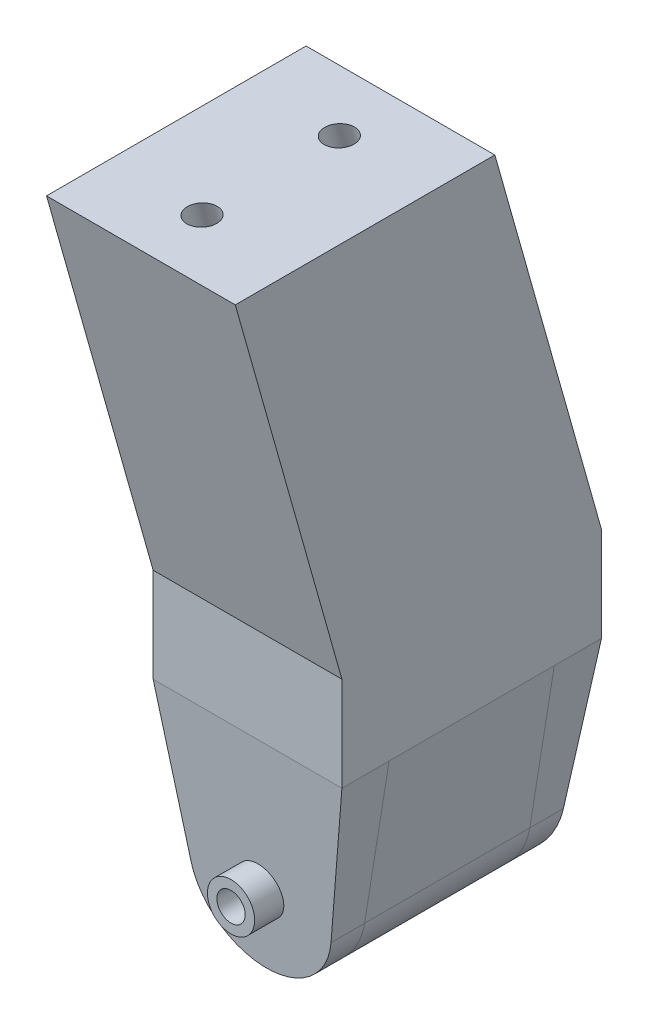
from build123d import *

# Parameters (mm, degrees)
CROQUIS1_W                          = 40
CROQUIS1_H                          = 55
SALIENTE_EXTRUIR1_DEPTH             = 20
SALIENTE_EXTRUIR2_REACH             = 41.449
SALIENTE_EXTRUIR2_DIRECTION_2_REACH = 41.449
CORTAR_EXTRUIR6_DEPTH               = 57.402570863
CORTAR_EXTRUIR6_DEPTH_BACK          = 57.402570863
CROQUIS6_R                          = 3
CORTAR_EXTRUIR10_DEPTH              = 10
CROQUIS11_R                         = 3
SALIENTE_EXTRUIR3_DEPTH             = 10
CORTAR_EXTRUIR11_DEPTH              = 57.402570863
CORTAR_EXTRUIR11_DEPTH_BACK         = 57.402570863
CORTAR_EXTRUIR15_START              = -10
CORTAR_EXTRUIR15_DEPTH              = 10
CROQUIS17_R                         = 3
SALIENTE_EXTRUIR4_DEPTH             = 10
CORTAR_EXTRUIR16_DEPTH              = 57.402570863
CORTAR_EXTRUIR16_DEPTH_BACK         = 57.402570863
CROQUIS21_R                         = 5
CROQUIS21_R_2                       = 3
SALIENTE_EXTRUIR5_DEPTH             = 3.5
SALIENTE_EXTRUIR5_DIRECTION_2_REACH = 75.824
CROQUIS22_R                         = 5
CROQUIS22_R_2                       = 3
SALIENTE_EXTRUIR6_DEPTH             = 3.5
SALIENTE_EXTRUIR6_DIRECTION_2_REACH = 78.467
BARRER1_START                       = -20
BARRER1_DEPTH                       = 40
CORTAR_EXTRUIR20_REACH              = 165.765
CROQUIS25_R                         = 3.1


# Read off the part's stored shape, not the designer's step: Barrer1
with BuildPart() as part:
    # Croquis1 → Saliente-Extruir1 (new body)
    with BuildSketch(Plane(origin=(0, 0, 0), x_dir=(1, 0, 0), z_dir=(0, 1, 0))):
        Rectangle(CROQUIS1_W, CROQUIS1_H)
    extrude(amount=SALIENTE_EXTRUIR1_DEPTH)

    # Saliente-Extruir2: up to this face of the body (flat: up to its plane)
    saliente_extruir2_end = Plane(part.part.faces().sort_by_distance((0, 10, 27.5))[0])
    # Croquis5 → Saliente-Extruir2 (add, up to the picked face)
    with BuildSketch(Plane.XY, mode=Mode.PRIVATE) as saliente_extruir2_sk1:
        with BuildLine():
            Line((-20, 0), (-14.810951292, -32.373967528))
            ThreePointArc((-14.810951292, -32.373967528), (0, -45), (14.810951292, -32.373967528))
            Line((14.810951292, -32.373967528), (20, 0))
            Line((20, 0), (-20, 0))
        make_face()
    saliente_extruir2_tool1 = split(extrude(saliente_extruir2_sk1.sketch, amount=SALIENTE_EXTRUIR2_REACH, mode=Mode.PRIVATE), bisect_by=saliente_extruir2_end, keep=Keep.BOTH, mode=Mode.PRIVATE)
    add(saliente_extruir2_tool1.solids().sort_by(Axis((0, -19.849245, 0), (0, 0, 1)))[0])

    # Saliente-Extruir2 direction 2: up to this face of the body (flat: up to its plane)
    saliente_extruir2_direction_2_end = Plane(part.part.faces().sort_by_distance((0, 10, -27.5))[0])
    # Croquis5 → Saliente-Extruir2 direction 2 (add, up to the picked face)
    with BuildSketch(Plane.XY, mode=Mode.PRIVATE) as saliente_extruir2_direction_2_sk1:
        with BuildLine():
            Line((-20, 0), (-14.810951292, -32.373967528))
            ThreePointArc((-14.810951292, -32.373967528), (0, -45), (14.810951292, -32.373967528))
            Line((14.810951292, -32.373967528), (20, 0))
            Line((20, 0), (-20, 0))
        make_face()
    saliente_extruir2_direction_2_tool1 = split(extrude(saliente_extruir2_direction_2_sk1.sketch, amount=-SALIENTE_EXTRUIR2_DIRECTION_2_REACH, mode=Mode.PRIVATE), bisect_by=saliente_extruir2_direction_2_end, keep=Keep.BOTH, mode=Mode.PRIVATE)
    add(saliente_extruir2_direction_2_tool1.solids().sort_by(Axis((0, -19.849245, 0), (0, 0, -1)))[0])

    # Croquis6 → Cortar-Extruir6 (cut, two sides: drawn at the far end of the back side and taken through both)
    with BuildSketch(Plane.XY.offset(-CORTAR_EXTRUIR6_DEPTH_BACK)):
        with Locations((0, -30)):
            Circle(CROQUIS6_R)
    extrude(amount=CORTAR_EXTRUIR6_DEPTH + CORTAR_EXTRUIR6_DEPTH_BACK, mode=Mode.SUBTRACT)

    # Croquis10 → Cortar-Extruir10 (cut)
    with BuildSketch(Plane(origin=(0, 0, -27.5), x_dir=(-1, 0, 0), z_dir=(0, 0, -1))):
        with BuildLine():
            Line((14.810951292, -32.373967528), (20, 0))
            Line((20, 0), (-20, 0))
            Line((-20, 0), (-14.810951292, -32.373967528))
            ThreePointArc((-14.810951292, -32.373967528), (0, -45), (14.810951292, -32.373967528))
        make_face()
    extrude(amount=-CORTAR_EXTRUIR10_DEPTH, mode=Mode.SUBTRACT)

    # Croquis16 → Cortar-Extruir15 (cut)
    with BuildSketch(Plane.XY.offset(27.5).offset(CORTAR_EXTRUIR15_START)):
        with BuildLine():
            Line((-20, 0), (20, 0))
            Line((20, 0), (14.810951292, -32.373967528))
            ThreePointArc((14.810951292, -32.373967528), (0, -45), (-14.810951292, -32.373967528))
            Line((-14.810951292, -32.373967528), (-20, 0))
        make_face()
    extrude(amount=CORTAR_EXTRUIR15_DEPTH, mode=Mode.SUBTRACT)

    # Barrer1 outline → Barrer1 (add)
    with BuildSketch(Plane.YZ.offset(BARRER1_START)):
        Polygon((20, -27.5), (100, -4.904361816), (100, 50.095638184), (20, 27.5), align=None)
    extrude(amount=BARRER1_DEPTH)

    # Cortar-Extruir20: up to this plane
    cortar_extruir20_end = Plane(origin=(0, 10, 0), z_dir=(0, 1, 0))
    # Croquis25 → Cortar-Extruir20 (cut, up to the surface)
    with BuildSketch(Plane(origin=(0, 105.715764038, 29.858939432), x_dir=(1, 0, 0), z_dir=(0, 0.9623504992532018, 0.27181154608867053)), mode=Mode.PRIVATE) as cortar_extruir20_sk1:
        with Locations(Location((0, 19.436230922, 0), (0, 0, 270))):
            Circle(CROQUIS25_R)
    cortar_extruir20_tool1 = split(extrude(cortar_extruir20_sk1.sketch, amount=-CORTAR_EXTRUIR20_REACH, mode=Mode.PRIVATE), bisect_by=cortar_extruir20_end, keep=Keep.BOTH, mode=Mode.PRIVATE)
    add(cortar_extruir20_tool1.solids().sort_by_distance((0, 110.998756, 11.154473))[0], mode=Mode.SUBTRACT)
    # Croquis25 → Cortar-Extruir20 (cut, up to the surface)
    with BuildSketch(Plane(origin=(0, 105.715764038, 29.858939432), x_dir=(1, 0, 0), z_dir=(0, 0.9623504992532018, 0.27181154608867053)), mode=Mode.PRIVATE) as cortar_extruir20_sk2:
        with Locations(Location((0, -8.563769078, 0), (0, 0, 270))):
            Circle(CROQUIS25_R)
    cortar_extruir20_tool2 = split(extrude(cortar_extruir20_sk2.sketch, amount=-CORTAR_EXTRUIR20_REACH, mode=Mode.PRIVATE), bisect_by=cortar_extruir20_end, keep=Keep.BOTH, mode=Mode.PRIVATE)
    add(cortar_extruir20_tool2.solids().sort_by_distance((0, 103.388033, 38.100287))[0], mode=Mode.SUBTRACT)


with BuildPart() as body_2:
    # Croquis11 → Saliente-Extruir3 (new body)
    with BuildSketch(Plane(origin=(0, 0, -17.5), x_dir=(-1, 0, 0), z_dir=(0, 0, -1))):
        with BuildLine():
            Line((20, 0), (-20, 0))
            Line((-20, 0), (-14.810951292, -32.373967528))
            ThreePointArc((-14.810951292, -32.373967528), (0, -45), (14.810951292, -32.373967528))
            Line((14.810951292, -32.373967528), (20, 0))
        make_face()
        with Locations((0, -30)):
            Circle(CROQUIS11_R, mode=Mode.SUBTRACT)
    extrude(amount=SALIENTE_EXTRUIR3_DEPTH)

    # Croquis12 → Cortar-Extruir11 (cut, two sides: drawn at the far end of the back side and taken through both)
    with BuildSketch(Plane(origin=(0, 0, 0), x_dir=(0, 0, -1), z_dir=(1, 0, 0)).offset(-CORTAR_EXTRUIR11_DEPTH_BACK)):
        with BuildLine():
            Line((27.5, 0), (23.5, -45))
            add(Edge.make_bspline(
                [(23.5, -45), (53.895048744, -65.691423054), (27.5, 0)],
                knots=[0, 0, 0, 1, 1, 1], degree=2))
        make_face()
    extrude(amount=CORTAR_EXTRUIR11_DEPTH + CORTAR_EXTRUIR11_DEPTH_BACK, mode=Mode.SUBTRACT)

    # Croquis22 → Saliente-Extruir6 (add)
    with BuildSketch(Plane(origin=(0, 0, -27.5), x_dir=(-1, 0, 0), z_dir=(0, 0, -1))):
        with Locations(Location((0, -30, 0), (0, 0, 180))):
            Circle(CROQUIS22_R)
        with Locations(Location((0, -30, 0), (0, 0, 180))):
            Circle(CROQUIS22_R_2, mode=Mode.SUBTRACT)
    extrude(amount=SALIENTE_EXTRUIR6_DEPTH)

    # Saliente-Extruir6 direction 2: up to this face of the body (flat: up to its plane)
    saliente_extruir6_direction_2_end = Plane(body_2.part.faces().sort_by_distance((0, -19.641450964, -25.754093248))[0])
    # Croquis22 → Saliente-Extruir6 direction 2 (add, up to the picked face)
    with BuildSketch(Plane(origin=(0, 0, -27.5), x_dir=(-1, 0, 0), z_dir=(0, 0, -1)), mode=Mode.PRIVATE) as saliente_extruir6_direction_2_sk1:
        with Locations(Location((0, -30, 0), (0, 0, 180))):
            Circle(CROQUIS22_R)
        with Locations(Location((0, -30, 0), (0, 0, 180))):
            Circle(CROQUIS22_R_2, mode=Mode.SUBTRACT)
    saliente_extruir6_direction_2_tool1 = split(extrude(saliente_extruir6_direction_2_sk1.sketch, amount=-SALIENTE_EXTRUIR6_DIRECTION_2_REACH, mode=Mode.PRIVATE), bisect_by=saliente_extruir6_direction_2_end, keep=Keep.BOTH, mode=Mode.PRIVATE)
    add(saliente_extruir6_direction_2_tool1.solids().sort_by(Axis((-4.858579, -30, -27.5), (0, 0, 1)))[0])


with BuildPart() as body_3:
    # Croquis17 → Saliente-Extruir4 (new body)
    with BuildSketch(Plane.XY.offset(17.5)):
        with BuildLine():
            Line((14.810951292, -32.373967528), (20, 0))
            Line((20, 0), (-20, 0))
            Line((-20, 0), (-14.810951292, -32.373967528))
            ThreePointArc((-14.810951292, -32.373967528), (0, -45), (14.810951292, -32.373967528))
        make_face()
        with Locations(Location((0, -30, 0), (0, 0, 180))):
            Circle(CROQUIS17_R, mode=Mode.SUBTRACT)
    extrude(amount=SALIENTE_EXTRUIR4_DEPTH)

    # Croquis18 → Cortar-Extruir16 (cut, two sides: drawn at the far end of the back side and taken through both)
    with BuildSketch(Plane(origin=(0, 0, 0), x_dir=(0, 0, -1), z_dir=(1, 0, 0)).offset(-CORTAR_EXTRUIR16_DEPTH_BACK)):
        with BuildLine():
            Line((-27.5, 0), (-23.5, -45))
            add(Edge.make_bspline(
                [(-23.5, -45), (-50.99373039, -70.964066745), (-27.5, 0)],
                knots=[0, 0, 0, 1, 1, 1], degree=2))
        make_face()
    extrude(amount=CORTAR_EXTRUIR16_DEPTH + CORTAR_EXTRUIR16_DEPTH_BACK, mode=Mode.SUBTRACT)

    # Croquis21 → Saliente-Extruir5 (add)
    with BuildSketch(Plane.XY.offset(27.5)):
        with Locations((0, -30)):
            Circle(CROQUIS21_R)
        with Locations((0, -30)):
            Circle(CROQUIS21_R_2, mode=Mode.SUBTRACT)
    extrude(amount=SALIENTE_EXTRUIR5_DEPTH)

    # Saliente-Extruir5 direction 2: up to this face of the body (flat: up to its plane)
    saliente_extruir5_direction_2_end = Plane(body_3.part.faces().sort_by_distance((0, -19.641450964, 25.754093248))[0])
    # Croquis21 → Saliente-Extruir5 direction 2 (add, up to the picked face)
    with BuildSketch(Plane.XY.offset(27.5), mode=Mode.PRIVATE) as saliente_extruir5_direction_2_sk1:
        with Locations((0, -30)):
            Circle(CROQUIS21_R)
        with Locations((0, -30)):
            Circle(CROQUIS21_R_2, mode=Mode.SUBTRACT)
    saliente_extruir5_direction_2_tool1 = split(extrude(saliente_extruir5_direction_2_sk1.sketch, amount=-SALIENTE_EXTRUIR5_DIRECTION_2_REACH, mode=Mode.PRIVATE), bisect_by=saliente_extruir5_direction_2_end, keep=Keep.BOTH, mode=Mode.PRIVATE)
    add(saliente_extruir5_direction_2_tool1.solids().sort_by(Axis((-4.858579, -30, 27.5), (0, 0, -1)))[0])


solid = Compound([part.part, body_2.part, body_3.part])
